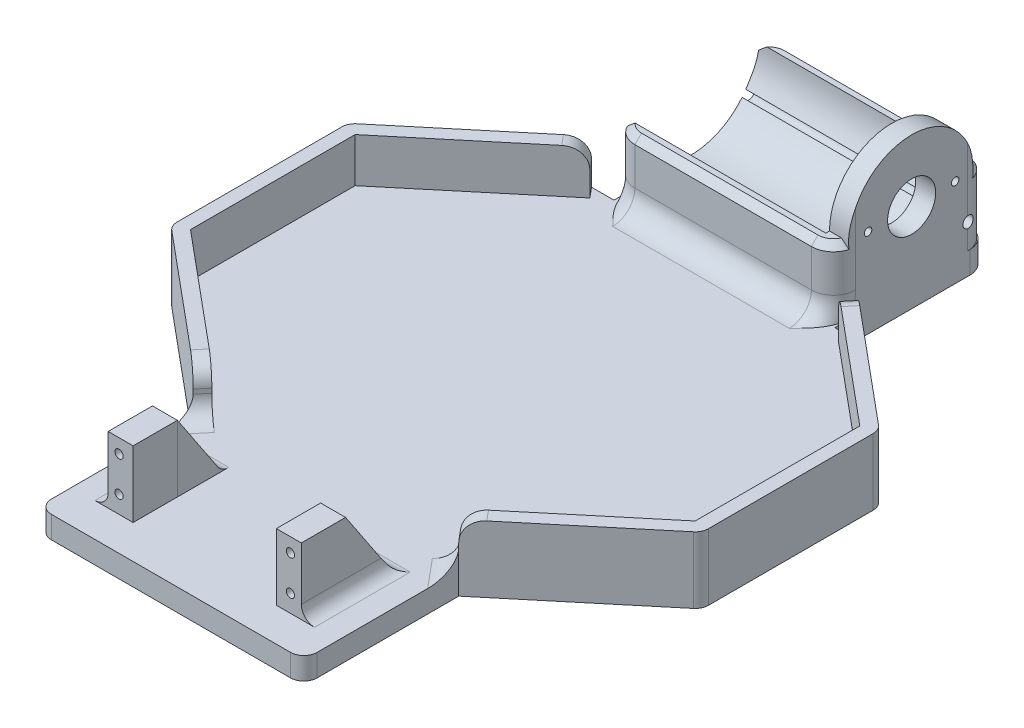
from build123d import *

# Parameters (mm, degrees)
BOSS_EXTRUDE1_DEPTH = 6.35
SKETCH2_W           = 7.1501
SKETCH2_H           = 12.7
BOSS_EXTRUDE2_DEPTH = 19.05
BOSS_EXTRUDE3_DEPTH = 7.1628
FILLET1_R           = 3.81
BOSS_EXTRUDE4_DEPTH = 12.7
FILLET3_R           = 5.715
SKETCH6_R           = 1.18745
CUT_EXTRUDE1_DEPTH  = 7.62
SKETCH7_W           = 63.3476
SKETCH7_H           = 44.8056
BOSS_EXTRUDE5_DEPTH = 38.1
CUT_EXTRUDE2_DEPTH  = 57.6326
CUT_EXTRUDE3_REACH  = 236.313
FILLET4_R           = 6.35
FILLET5_R           = 6.35
CHAMFER1_SIZE       = 1.905
CUT_EXTRUDE4_REACH  = 236.085
SKETCH11_R          = 6.8961
SKETCH11_R_2        = 1.07315
CUT_EXTRUDE5_REACH  = 222.129
SKETCH12_W          = 6.4262
SKETCH12_H          = 44.45
FILLET6_R           = 5.715
CUT_EXTRUDE6_REACH  = 236.085
SKETCH13_R          = 1.6


with BuildPart() as part:
    # Sketch1 → Boss-Extrude1 (new body)
    with BuildSketch(Plane(origin=(0, 0, 0), x_dir=(1, 0, 0), z_dir=(0, 1, 0))):
        with BuildLine():
            ThreePointArc((-38.1, 199.39), (-36.984076836, 202.084076836), (-34.29, 203.2))
            Line((-34.29, 203.2), (34.29, 203.2))
            ThreePointArc((34.29, 203.2), (36.984076836, 202.084076836), (38.1, 199.39))
            Line((38.1, 199.39), (38.1, 158.75))
            Line((38.1, 158.75), (74.829102563, 128.142414531))
            ThreePointArc((74.829102563, 128.142414531), (75.840295695, 126.831523516), (76.2, 125.215491456))
            Line((76.2, 125.215491456), (76.2, 77.984508544))
            ThreePointArc((76.2, 77.984508544), (75.840295695, 76.368476484), (74.829102563, 75.057585469))
            Line((74.829102563, 75.057585469), (38.1, 44.45))
            Line((38.1, 44.45), (38.1, 3.81))
            ThreePointArc((38.1, 3.81), (36.984076836, 1.115923164), (34.29, 0))
            Line((34.29, 0), (-34.29, 0))
            ThreePointArc((-34.29, 0), (-36.984076836, 1.115923164), (-38.1, 3.81))
            Line((-38.1, 3.81), (-38.1, 44.45))
            Line((-38.1, 44.45), (-74.829102563, 75.057585469))
            ThreePointArc((-74.829102563, 75.057585469), (-75.840295695, 76.368476484), (-76.2, 77.984508544))
            Line((-76.2, 77.984508544), (-76.2, 125.215491456))
            ThreePointArc((-76.2, 125.215491456), (-75.840295695, 126.831523516), (-74.829102563, 128.142414531))
            Line((-74.829102563, 128.142414531), (-38.1, 158.75))
            Line((-38.1, 158.75), (-38.1, 199.39))
        make_face()
    extrude(amount=BOSS_EXTRUDE1_DEPTH)

    # Sketch2 → Boss-Extrude2 (add)
    with BuildSketch(Plane(origin=(0, 6.35, 0), x_dir=(1, 0, 0), z_dir=(0, 1, 0))):
        with Locations((24.12365, 16.0274)):
            Rectangle(SKETCH2_W, SKETCH2_H)
        with Locations((-24.12365, 16.0274)):
            Rectangle(SKETCH2_W, SKETCH2_H)
    extrude(amount=BOSS_EXTRUDE2_DEPTH)

    # Sketch3 → Boss-Extrude3 (add)
    with BuildSketch(Plane.ZY.offset(27.6987)):
        Polygon((-22.3774, 25.4), (-35.0774, 6.35), (-22.3774, 6.35), align=None)
    boss_extrude3 = extrude(amount=-BOSS_EXTRUDE3_DEPTH)

    # Mirror1: Boss-Extrude3 across plane
    add(boss_extrude3.mirror(Plane.ZY))

    # Fillet1
    fillet1_edges = [part.edges().sort_by_distance(p)[0] for p in [
        (24.1173, 6.35, -35.0774),
        (27.6987, 6.35, -22.3774),
        (-27.6987, 6.35, -22.3774),
        (-24.1173, 6.35, -35.0774),
    ]]
    fillet(fillet1_edges, radius=FILLET1_R)

    # Sketch4 → Boss-Extrude4 (add)
    with BuildSketch(Plane(origin=(0, 6.35, 0), x_dir=(1, 0, 0), z_dir=(0, 1, 0))):
        with BuildLine():
            Line((-38.1, 158.75), (-74.829102563, 128.142414531))
            ThreePointArc((-74.829102563, 128.142414531), (-75.840295695, 126.831523516), (-76.2, 125.215491456))
            Line((-76.2, 125.215491456), (-76.2, 77.984508544))
            ThreePointArc((-76.2, 77.984508544), (-75.840295695, 76.368476484), (-74.829102563, 75.057585469))
            Line((-74.829102563, 75.057585469), (-38.1, 44.45))
            Line((-38.1, 44.45), (-35.660897437, 47.376923075))
            Line((-35.660897437, 47.376923075), (-72.39, 77.984508544))
            Line((-72.39, 77.984508544), (-72.39, 125.215491456))
            Line((-72.39, 125.215491456), (-35.660897437, 155.823076925))
            Line((-35.660897437, 155.823076925), (-38.1, 158.75))
        make_face()
        with BuildLine():
            Line((35.660897437, 155.823076925), (72.39, 125.215491456))
            Line((72.39, 125.215491456), (72.39, 77.984508544))
            Line((72.39, 77.984508544), (35.660897437, 47.376923075))
            Line((35.660897437, 47.376923075), (38.1, 44.45))
            Line((38.1, 44.45), (74.829102563, 75.057585469))
            ThreePointArc((74.829102563, 75.057585469), (75.840295695, 76.368476484), (76.2, 77.984508544))
            Line((76.2, 77.984508544), (76.2, 125.215491456))
            ThreePointArc((76.2, 125.215491456), (75.840295695, 126.831523516), (74.829102563, 128.142414531))
            Line((74.829102563, 128.142414531), (38.1, 158.75))
            Line((38.1, 158.75), (35.660897437, 155.823076925))
        make_face()
    extrude(amount=BOSS_EXTRUDE4_DEPTH)

    # Fillet3
    fillet3_edges = [part.edges().sort_by_distance(p)[0] for p in [
        (-36.880448719, 6.35, -45.913461538),
        (-36.880448719, 19.05, -157.286538462),
        (-36.880448719, 19.05, -45.913461538),
        (36.880448719, 6.35, -45.913461538),
        (36.880448719, 19.05, -157.286538462),
        (36.880448719, 19.05, -45.913461538),
    ]]
    fillet(fillet3_edges, radius=FILLET3_R)

    # Sketch6 → Cut-Extrude1 (cut)
    with BuildSketch(Plane.XY.offset(-9.6774)):
        with Locations((-24.5745, 11.3538)):
            Circle(SKETCH6_R)
        with Locations((-24.5745, 21.3614)):
            Circle(SKETCH6_R)
    cut_extrude1 = extrude(amount=-CUT_EXTRUDE1_DEPTH, mode=Mode.SUBTRACT)

    # Mirror2: Cut-Extrude1 across plane
    add(cut_extrude1.mirror(Plane.ZY), mode=Mode.SUBTRACT)

    # Sketch7 → Boss-Extrude5 (add)
    with BuildSketch(Plane(origin=(0, 6.35, 0), x_dir=(1, 0, 0), z_dir=(0, 1, 0))):
        with Locations((0, 180.7972)):
            Rectangle(SKETCH7_W, SKETCH7_H)
    extrude(amount=BOSS_EXTRUDE5_DEPTH)

    # Sketch8 → Cut-Extrude2 (cut)
    with BuildSketch(Plane.ZY.offset(31.6738)):
        with BuildLine():
            Line((-161.8869, 25.4), (-158.3944, 25.4))
            Line((-158.3944, 25.4), (-158.3944, 44.45))
            Line((-158.3944, 44.45), (-203.2, 44.45))
            Line((-203.2, 44.45), (-203.2, 25.4))
            Line((-203.2, 25.4), (-199.7075, 25.4))
            ThreePointArc((-199.7075, 25.4), (-180.7972, 6.4897), (-161.8869, 25.4))
        make_face()
    extrude(amount=-CUT_EXTRUDE2_DEPTH, mode=Mode.SUBTRACT)

    # Sketch10 → Cut-Extrude3 (cut, up to next)
    with BuildSketch(Plane(origin=(31.6738, 0, 0), x_dir=(0, 0, -1), z_dir=(1, 0, 0)), mode=Mode.PRIVATE) as cut_extrude3_sk1:
        with BuildLine():
            Line((158.3944, 44.45), (203.2, 44.45))
            Line((203.2, 44.45), (203.2, 25.4))
            Line((203.2, 25.4), (198.653381935, 25.4))
            ThreePointArc((198.653381935, 25.4), (180.7972, 43.2308), (162.941018065, 25.4))
            Line((162.941018065, 25.4), (158.3944, 25.4))
            Line((158.3944, 25.4), (158.3944, 44.45))
        make_face()
    cut_extrude3_tool1 = extrude(cut_extrude3_sk1.sketch, amount=-CUT_EXTRUDE3_REACH, mode=Mode.PRIVATE) & part.part
    add(cut_extrude3_tool1.solids().sort_by_distance((31.6738, 43.963128, -180.7972))[0], mode=Mode.SUBTRACT)

    # Fillet4
    fillet4_edges = [part.edges().sort_by_distance(p)[0] for p in [
        (0, 6.35, -158.3944),
    ]]
    fillet(fillet4_edges, radius=FILLET4_R)

    # Fillet5
    # the kernel refuses this fillet: 6.35 mm, written as the material it takes off along each edge
    with BuildSketch(Plane(origin=(-31.6738, 12.7, -152.0444), x_dir=(0, 0.8017442392976492, 0.5976672776328265), z_dir=(0, 0.5976672776328265, -0.8017442392976492))) as fillet5_piece_1_section:
        with BuildLine():
            CenterArc((6.35 + FILLET5_R, FILLET5_R), FILLET5_R, 180, 90)
            Line((6.35 + FILLET5_R, 0), (6.35, 0))
            Line((6.35, 0), (6.35, FILLET5_R))
        make_face()
    fillet5_piece_1 = revolve(axis=Axis((-31.6738, 12.7, -152.0444), (1, 0, 0)), revolution_arc=233.296989237, mode=Mode.PRIVATE)
    fillet5_piece_1 = split(fillet5_piece_1, bisect_by=Plane(origin=(-29.694960171, 6.35, -156.806512343), z_dir=(0, 1, 0)), keep=Keep.TOP, mode=Mode.PRIVATE)
    add(fillet5_piece_1, mode=Mode.SUBTRACT)
    with BuildSketch(Plane(origin=(31.6738, 12.7, -152.0444), x_dir=(0, 0.8017442392976495, 0.5976672776328259), z_dir=(0, 0.5976672776328259, -0.8017442392976495))) as fillet5_piece_2_section:
        with BuildLine():
            CenterArc((6.35 + FILLET5_R, -FILLET5_R), FILLET5_R, 90, 90)
            Line((6.35, -FILLET5_R), (6.35, 0))
            Line((6.35, 0), (6.35 + FILLET5_R, 0))
        make_face()
    fillet5_piece_2 = revolve(axis=Axis((31.6738, 12.7, -152.0444), (1, 0, 0)), revolution_arc=233.296989237, mode=Mode.PRIVATE)
    fillet5_piece_2 = split(fillet5_piece_2, bisect_by=Plane(origin=(29.694960125, 6.35, -156.806512204), z_dir=(0, 1, 0)), keep=Keep.TOP, mode=Mode.PRIVATE)
    add(fillet5_piece_2, mode=Mode.SUBTRACT)
    with BuildSketch(Plane(origin=(-31.6738, 6.35, -203.2), x_dir=(1, 0, 0), z_dir=(0, 1, 0))) as fillet5_piece_3:
        with BuildLine():
            CenterArc((FILLET5_R, -FILLET5_R), FILLET5_R, 90, 90)
            Line((0, -FILLET5_R), (0, 0))
            Line((0, 0), (FILLET5_R, 0))
        make_face()
    extrude(amount=34.925, mode=Mode.SUBTRACT)
    with BuildSketch(Plane(origin=(-31.6738, 12.7, -158.3944), x_dir=(1, 0, 0), z_dir=(0, 1, 0))) as fillet5_piece_4:
        with BuildLine():
            CenterArc((FILLET5_R, FILLET5_R), FILLET5_R, 180, 90)
            Line((0, FILLET5_R), (0, 0))
            Line((0, 0), (FILLET5_R, 0))
        make_face()
    extrude(amount=28.575, mode=Mode.SUBTRACT)
    with BuildSketch(Plane(origin=(31.6738, 6.35, -203.2), x_dir=(-1, 0, 0), z_dir=(0, 1, 0))) as fillet5_piece_5:
        with BuildLine():
            CenterArc((FILLET5_R, FILLET5_R), FILLET5_R, 180, 90)
            Line((0, FILLET5_R), (0, 0))
            Line((0, 0), (FILLET5_R, 0))
        make_face()
    extrude(amount=34.925, mode=Mode.SUBTRACT)
    with BuildSketch(Plane(origin=(31.6738, 12.7, -158.3944), x_dir=(-1, 0, 0), z_dir=(0, 1, 0))) as fillet5_piece_6:
        with BuildLine():
            CenterArc((FILLET5_R, -FILLET5_R), FILLET5_R, 90, 90)
            Line((0, -FILLET5_R), (0, 0))
            Line((0, 0), (FILLET5_R, 0))
        make_face()
    extrude(amount=28.575, mode=Mode.SUBTRACT)

    # Chamfer1
    # the kernel refuses this chamfer: 1.905 mm, written as the material it takes off along each edge
    with BuildSketch(Plane(origin=(25.3238, 25.4, -164.7444), x_dir=(0.8852564477160864, 0, -0.4651032377624307), z_dir=(-0.4651032377624307, 0, -0.8852564477160864))) as chamfer1_piece_1_section:
        Polygon((6.35, CHAMFER1_SIZE), (6.35 - CHAMFER1_SIZE, 0), (6.35, 0), align=None)
    chamfer1_piece_1 = revolve(axis=Axis((25.3238, 25.4, -164.7444), (0, -1, 0)), revolution_arc=117.716903624, mode=Mode.PRIVATE)
    chamfer1_piece_1 = chamfer1_piece_1 - Plane(origin=(28.496975457, 25.3746, -180.7972), x_dir=(0, 0.0014224751066874927, -0.9999989882817737), z_dir=(1, 0, 0)) * Cylinder(17.8562, 26, mode=Mode.PRIVATE)
    add(chamfer1_piece_1, mode=Mode.SUBTRACT)
    with BuildSketch(Plane(origin=(-25.3238, 25.4, -164.7444), x_dir=(0, 0, 1), z_dir=(1, 0, 0))) as chamfer1_piece_2:
        Polygon((6.35, CHAMFER1_SIZE), (6.35 - CHAMFER1_SIZE, 0), (6.35, 0), align=None)
    revolve(axis=Axis((-25.3238, 25.4, -164.7444), (0, -1, 0)), revolution_arc=107.46906116, mode=Mode.SUBTRACT)
    with BuildSketch(Plane(origin=(25.3238, 25.4, -158.3944), x_dir=(0, -0.9996219169112969, 0.027495876610582788), z_dir=(-1, 0, 0)), Plane(origin=(-25.3238, 25.4, -203.2), x_dir=(0, -0.9996219169112969, -0.02749587661058274), z_dir=(1, 0, 0))) as chamfer1_piece_3:
        Polygon((CHAMFER1_SIZE * 0.999621916911, -CHAMFER1_SIZE * 0.0274958766106), (-CHAMFER1_SIZE * 0.0274958766106, -CHAMFER1_SIZE * 0.999621916911), (0, 0), align=None)
    extrude(amount=50.6476, mode=Mode.SUBTRACT)
    with BuildSketch(Plane(origin=(25.3238, 25.4, -196.85), x_dir=(0, 0, -1), z_dir=(-1, 0, 0))) as chamfer1_piece_4_section:
        Polygon((6.35, CHAMFER1_SIZE), (6.35 - CHAMFER1_SIZE, 0), (6.35, 0), align=None)
    chamfer1_piece_4 = revolve(axis=Axis((25.3238, 25.4, -196.85), (0, -1, 0)), revolution_arc=117.716903624, mode=Mode.PRIVATE)
    chamfer1_piece_4 = chamfer1_piece_4 - Plane(origin=(28.496975458, 25.3746, -180.7972), x_dir=(0, 0.0014224751066874927, -0.9999989882817737), z_dir=(1, 0, 0)) * Cylinder(17.8562, 26, mode=Mode.PRIVATE)
    add(chamfer1_piece_4, mode=Mode.SUBTRACT)
    with BuildSketch(Plane(origin=(-25.3238, 25.4, -196.85), x_dir=(-0.9538791882042058, 0, 0.30019076320047755), z_dir=(0.30019076320047755, 0, 0.9538791882042058))) as chamfer1_piece_5:
        Polygon((6.35, CHAMFER1_SIZE), (6.35 - CHAMFER1_SIZE, 0), (6.35, 0), align=None)
    revolve(axis=Axis((-25.3238, 25.4, -196.85), (0, -1, 0)), revolution_arc=107.46906116, mode=Mode.SUBTRACT)

    # Sketch11 → Cut-Extrude4 (cut, up to next)
    with BuildSketch(Plane(origin=(31.6738, 0, 0), x_dir=(0, 0, -1), z_dir=(1, 0, 0)), mode=Mode.PRIVATE) as cut_extrude4_sk1:
        with Locations((180.7972, 25.4)):
            Circle(SKETCH11_R)
    cut_extrude4_tool1 = extrude(cut_extrude4_sk1.sketch, amount=-CUT_EXTRUDE4_REACH, mode=Mode.PRIVATE) & part.part
    # Sketch11 → Cut-Extrude4 (cut, up to next)
    with BuildSketch(Plane(origin=(31.6738, 0, 0), x_dir=(0, 0, -1), z_dir=(1, 0, 0)), mode=Mode.PRIVATE) as cut_extrude4_sk2:
        with Locations((193.294, 25.4)):
            Circle(SKETCH11_R_2)
    cut_extrude4_tool2 = extrude(cut_extrude4_sk2.sketch, amount=-CUT_EXTRUDE4_REACH, mode=Mode.PRIVATE) & part.part
    # Sketch11 → Cut-Extrude4 (cut, up to next)
    with BuildSketch(Plane(origin=(31.6738, 0, 0), x_dir=(0, 0, -1), z_dir=(1, 0, 0)), mode=Mode.PRIVATE) as cut_extrude4_sk3:
        with Locations((168.3004, 25.4)):
            Circle(SKETCH11_R_2)
    cut_extrude4_tool3 = extrude(cut_extrude4_sk3.sketch, amount=-CUT_EXTRUDE4_REACH, mode=Mode.PRIVATE) & part.part
    add(cut_extrude4_tool1.solids().sort_by_distance((31.6738, 25.4, -180.7972))[0], mode=Mode.SUBTRACT)
    add(cut_extrude4_tool2.solids().sort_by_distance((31.6738, 25.4, -193.294))[0], mode=Mode.SUBTRACT)
    add(cut_extrude4_tool3.solids().sort_by_distance((31.6738, 25.4, -168.3004))[0], mode=Mode.SUBTRACT)

    # Sketch12 → Cut-Extrude5 (cut, up to next)
    with BuildSketch(Plane(origin=(0, 6.35, 0), x_dir=(1, 0, 0), z_dir=(0, 1, 0)), mode=Mode.PRIVATE) as cut_extrude5_sk1:
        with Locations((-34.8869, 180.975)):
            Rectangle(SKETCH12_W, SKETCH12_H)
    cut_extrude5_tool1 = extrude(cut_extrude5_sk1.sketch, amount=-CUT_EXTRUDE5_REACH, mode=Mode.PRIVATE) & part.part
    # Sketch12 → Cut-Extrude5 (cut, up to next)
    with BuildSketch(Plane(origin=(0, 6.35, 0), x_dir=(1, 0, 0), z_dir=(0, 1, 0)), mode=Mode.PRIVATE) as cut_extrude5_sk2:
        with Locations((34.8869, 180.975)):
            Rectangle(SKETCH12_W, SKETCH12_H)
    cut_extrude5_tool2 = extrude(cut_extrude5_sk2.sketch, amount=-CUT_EXTRUDE5_REACH, mode=Mode.PRIVATE) & part.part
    add(cut_extrude5_tool1.solids().sort_by_distance((-34.8869, 6.35, -180.975))[0], mode=Mode.SUBTRACT)
    add(cut_extrude5_tool2.solids().sort_by_distance((34.8869, 6.35, -180.975))[0], mode=Mode.SUBTRACT)

    # Fillet6
    fillet6_edges = [part.edges().sort_by_distance(p)[0] for p in [
        (-31.6738, 3.175, -203.2),
        (31.6738, 3.175, -203.2),
    ]]
    fillet(fillet6_edges, radius=FILLET6_R)

    # Sketch13 → Cut-Extrude6 (cut, up to next)
    with BuildSketch(Plane.ZY.offset(31.6738), mode=Mode.PRIVATE) as cut_extrude6_sk1:
        with Locations(Location((-197.104, 13.462, 0), (0, 0, 279.134349204))):
            Circle(SKETCH13_R)
    cut_extrude6_tool1 = extrude(cut_extrude6_sk1.sketch, amount=-CUT_EXTRUDE6_REACH, mode=Mode.PRIVATE) & part.part
    add(cut_extrude6_tool1.solids().sort_by_distance((-31.6738, 13.462, -197.104))[0], mode=Mode.SUBTRACT)


solid = part.part
